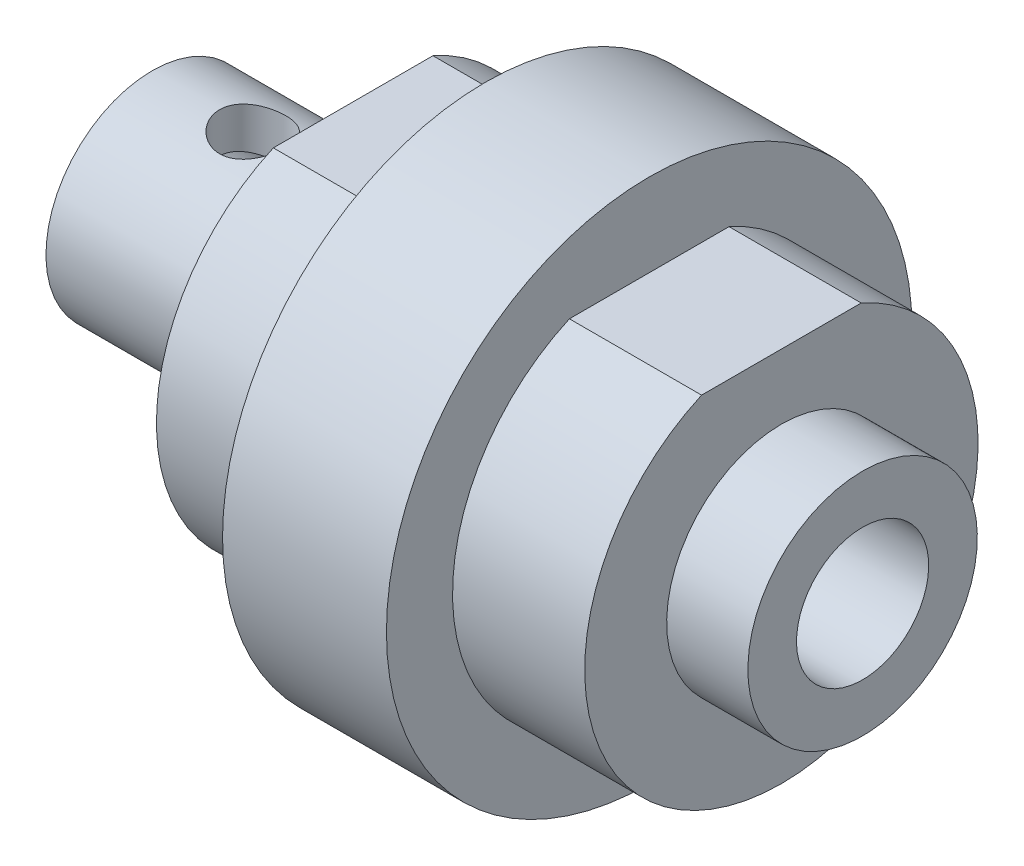
from build123d import *

# Parameters (mm, degrees)
CUT_EXTRUDE1_DEPTH      = 39.514968698
CUT_EXTRUDE1_DEPTH_BACK = 39.514968698
SKETCH2_W               = 6.35
SKETCH2_H               = 0.8128
CUT_EXTRUDE2_DEPTH      = 39.514968698
CUT_EXTRUDE2_DEPTH_BACK = 39.514968698
SKETCH3_R               = 1.5875


with BuildPart() as part:
    # Sketch1 → Revolve1 (revolve)
    with BuildSketch(Plane.XY):
        Polygon((0, 5.1054), (0, 3.175), (34.12744, 3.175), (34.12744, 5.5118), (30.226, 5.5118), (30.226, 9.4488), (23.876, 9.4488), (23.876, 12.6238), (16.002, 12.6238), (16.002, 9.4488), (9.652, 9.4488), (9.652, 5.1054), align=None)
    revolve(axis=Axis((34.12744, 0, 0), (-1, 0, 0)))

    # Sketch2 → Cut-Extrude1 (cut, two sides: drawn at the far end of the back side and taken through both)
    with BuildSketch(Plane.XY.offset(-CUT_EXTRUDE1_DEPTH_BACK)):
        with Locations((12.827, 9.0424)):
            Rectangle(SKETCH2_W, SKETCH2_H)
        with Locations((27.051, 9.0424)):
            Rectangle(SKETCH2_W, SKETCH2_H)
    extrude(amount=CUT_EXTRUDE1_DEPTH + CUT_EXTRUDE1_DEPTH_BACK, mode=Mode.SUBTRACT)

    # Sketch3 → Cut-Extrude2 (cut, two sides: drawn at the far end of the back side and taken through both)
    with BuildSketch(Plane(origin=(0, 0, 0), x_dir=(1, 0, 0), z_dir=(0, 1, 0)).offset(-CUT_EXTRUDE2_DEPTH_BACK)):
        with Locations((4.826, 0)):
            Circle(SKETCH3_R)
    extrude(amount=CUT_EXTRUDE2_DEPTH + CUT_EXTRUDE2_DEPTH_BACK, mode=Mode.SUBTRACT)


solid = part.part
